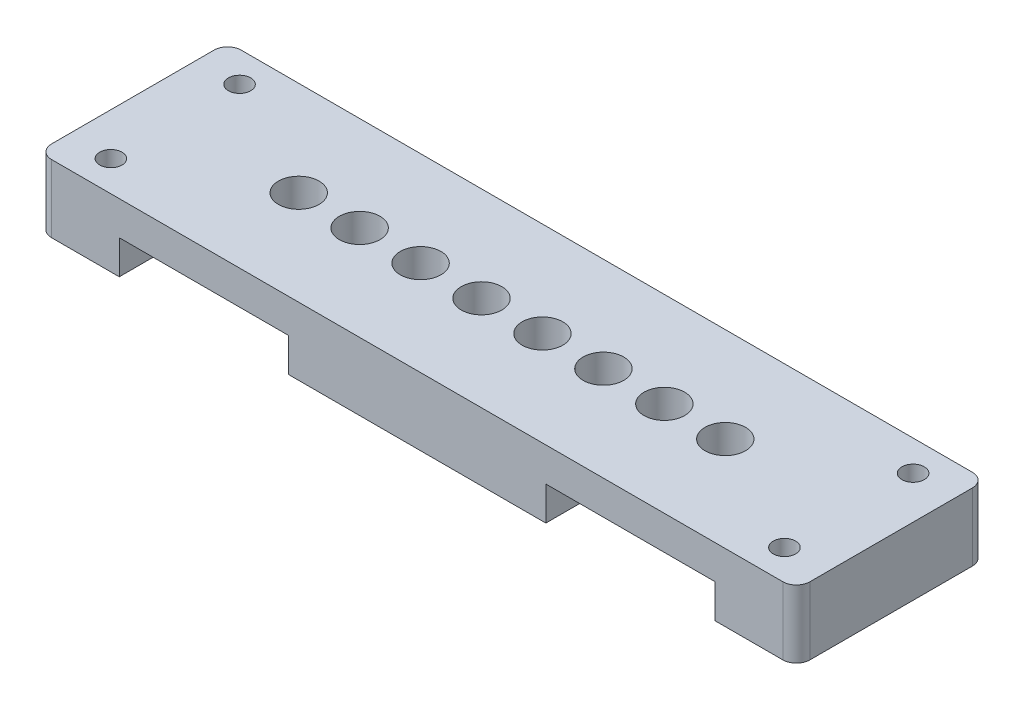
from build123d import *

# Parameters (mm, degrees)
SKETCH1_W                 = 56
SKETCH1_H                 = 10
BOSS_EXTRUDE1_DEPTH       = 14
SKETCH9_W                 = 25
SKETCH9_H                 = 8
CUT_EXTRUDE2_DEPTH        = 5
CHAMFER2_SIZE             = 5
SKETCH10_R                = 3
CUT_EXTRUDE3_DEPTH        = 59.583274064
F_3_0MM_DOWEL_HOLE1_D     = 3.3
F_3_0MM_DOWEL_HOLE1_DEPTH = 8
F_3_0MM_DOWEL_HOLE1_TIP   = 0.991420021
FILLET1_R                 = 2


with BuildPart() as part:
    # Sketch1 → Boss-Extrude1 (new, symmetric)
    with BuildSketch(Plane.XY):
        with Locations((-28, 5)):
            Rectangle(SKETCH1_W, SKETCH1_H)
    extrude(amount=BOSS_EXTRUDE1_DEPTH, both=True)

    # Sketch9 → Cut-Extrude2 (cut)
    with BuildSketch(Plane(origin=(0, 0, 0), x_dir=(1, 0, 0), z_dir=(0, 1, 0))):
        with Locations((-31.5, 10)):
            Rectangle(SKETCH9_W, SKETCH9_H)
        with Locations((-31.5, -10)):
            Rectangle(SKETCH9_W, SKETCH9_H)
    extrude(amount=CUT_EXTRUDE2_DEPTH, mode=Mode.SUBTRACT)

    # Chamfer2
    chamfer2_edges = [part.edges().sort_by_distance(p)[0] for p in [
        (-31.5, 5, -6),
        (-31.5, 5, 6),
    ]]
    chamfer(chamfer2_edges, length=CHAMFER2_SIZE - 0.0001)  # a hair under: the kernel refuses the full size

    # Sketch10 → Cut-Extrude3 (cut, through all)
    with BuildSketch(Plane(origin=(0, 10, 0), x_dir=(1, 0, 0), z_dir=(0, 1, 0))):
        with Locations(Location((-4.5, 0, 0), (0, 0, 270))):
            Circle(SKETCH10_R)
        with Locations(Location((-13.5, 0, 0), (0, 0, 270))):
            Circle(SKETCH10_R)
        with Locations(Location((-22.5, 0, 0), (0, 0, 270))):
            Circle(SKETCH10_R)
        with Locations(Location((-31.5, 0, 0), (0, 0, 270))):
            Circle(SKETCH10_R)
    extrude(amount=-CUT_EXTRUDE3_DEPTH, mode=Mode.SUBTRACT)

    # Mirror1: part across plane


with BuildPart() as part_1:
    add(part.part)
    add(part.part.mirror(Plane(origin=(0, 10, 14), x_dir=(0, 0, 1), z_dir=(-1, 0, 0))))

    # Ø3.0mm Dowel Hole1
    with Locations(Plane(origin=(0, 10, 0), x_dir=(1, 0, 0), z_dir=(0, 1, 0))):
        with Locations((49.74, 9.5), (-49.74, -9.5), (-49.74, 9.5), (49.74, -9.5)):
            Hole(F_3_0MM_DOWEL_HOLE1_D / 2, depth=F_3_0MM_DOWEL_HOLE1_DEPTH)
            with Locations((0, 0, -(F_3_0MM_DOWEL_HOLE1_DEPTH + F_3_0MM_DOWEL_HOLE1_TIP / 2))):  # 118° drill point
                Cone(0, F_3_0MM_DOWEL_HOLE1_D / 2, F_3_0MM_DOWEL_HOLE1_TIP, mode=Mode.SUBTRACT)

    # Fillet1
    fillet1_edges = [part_1.edges().sort_by_distance(p)[0] for p in [
        (-56, 5, 14),
        (-56, 5, -14),
        (56, 5, -14),
        (56, 5, 14),
    ]]
    fillet(fillet1_edges, radius=FILLET1_R)


solid = part_1.part
